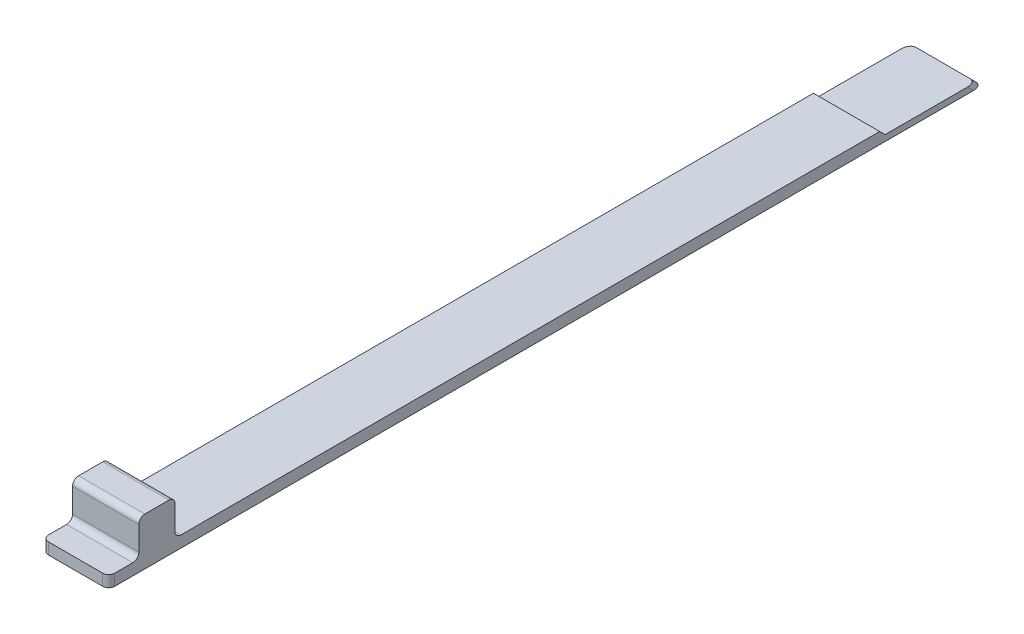
from build123d import *

# Parameters (mm, degrees)
SZKIC1_W                    = 11
SZKIC1_H                    = 145
DODANIE_WYCI_GNI_CIE1_DEPTH = 1.9
SZKIC3_W                    = 11
SZKIC3_H                    = 16
WYTNIJ_WYCI_GNI_CIE1_DEPTH  = 0.9
SFAZOWANIE1_SIZE            = 1
SZKIC2_W                    = 11
SZKIC2_H                    = 6
DODANIE_WYCI_GNI_CIE2_DEPTH = 6
ZAOKR_GLENIE1_R             = 1


with BuildPart() as part:
    # Szkic1 → Dodanie-wyciągnięcie1 (new body)
    with BuildSketch(Plane(origin=(0, 0, 0), x_dir=(1, 0, 0), z_dir=(0, 1, 0))):
        Rectangle(SZKIC1_W, SZKIC1_H)
    extrude(amount=DODANIE_WYCI_GNI_CIE1_DEPTH)

    # Szkic3 → Wytnij-wyciągnięcie1 (cut)
    with BuildSketch(Plane(origin=(0, 1.9, 0), x_dir=(1, 0, 0), z_dir=(0, 1, 0))):
        with Locations((0, 64.5)):
            Rectangle(SZKIC3_W, SZKIC3_H)
    extrude(amount=-WYTNIJ_WYCI_GNI_CIE1_DEPTH, mode=Mode.SUBTRACT)

    # Sfazowanie1
    # the kernel refuses this chamfer: 1 mm, written as the material it takes off along each edge
    with BuildSketch(Plane(origin=(-8.071682988, 1.9, -56.5), x_dir=(0, 0.0274958766105862, 0.9996219169112968), z_dir=(1, 0, 0))) as sfazowanie1_piece_1_section:
        Polygon((SFAZOWANIE1_SIZE * 0.999621916911, SFAZOWANIE1_SIZE * 0.0274958766106), (-SFAZOWANIE1_SIZE * 0.0274958766106, SFAZOWANIE1_SIZE * 0.999621916911), (0, 0), align=None)
    sfazowanie1_piece_1 = extrude(amount=16.143365976, mode=Mode.PRIVATE)
    sfazowanie1_piece_1 = split(sfazowanie1_piece_1, bisect_by=Plane(origin=(0, 1, -56.164099253), z_dir=(0, 1, 0)), keep=Keep.TOP, mode=Mode.PRIVATE)
    add(sfazowanie1_piece_1, mode=Mode.SUBTRACT)
    with BuildSketch(Plane(origin=(8.071682988, 1, -72.5), x_dir=(0, -0.999621916911297, -0.02749587661058218), z_dir=(-1, 0, 0))) as sfazowanie1_piece_2:
        Polygon((SFAZOWANIE1_SIZE * 0.999621916911, SFAZOWANIE1_SIZE * 0.0274958766106), (-SFAZOWANIE1_SIZE * 0.0274958766106, SFAZOWANIE1_SIZE * 0.999621916911), (0, 0), align=None)
    extrude(amount=16.143365976, mode=Mode.SUBTRACT)

    # Szkic2 → Dodanie-wyciągnięcie2 (add)
    with BuildSketch(Plane(origin=(0, 1.9, 0), x_dir=(1, 0, 0), z_dir=(0, 1, 0))):
        with Locations((0, -64.5)):
            Rectangle(SZKIC2_W, SZKIC2_H)
    extrude(amount=DODANIE_WYCI_GNI_CIE2_DEPTH)

    # Zaokrąglenie1
    zaokr_glenie1_edges = [part.edges().sort_by_distance(p)[0] for p in [
        (5.5, 0.5, -72),
        (-5.5, 0.5, -72),
        (0, 1.9, 67.5),
        (0, 1.9, 61.5),
        (0, 7.9, 67.5),
        (0, 7.9, 61.5),
        (5.5, 0.95, 72.5),
        (-5.5, 0.95, 72.5),
    ]]
    fillet(zaokr_glenie1_edges, radius=ZAOKR_GLENIE1_R)


solid = part.part
